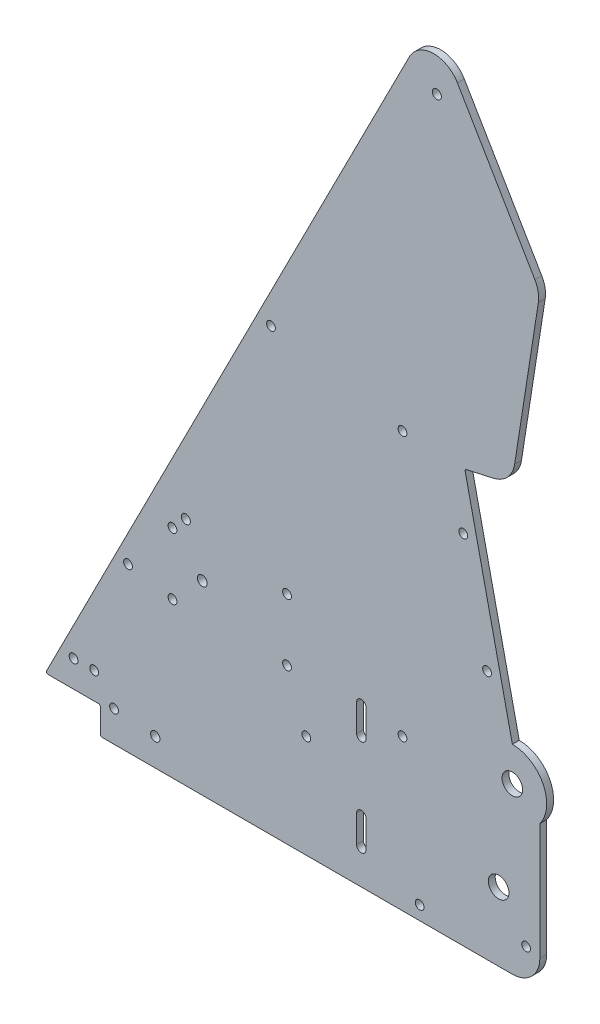
from build123d import *

# Parameters (mm, degrees)
BOSS_EXTRUDE1_DEPTH = 3.175
SKETCH2_R           = 2.0955
SKETCH2_R_2         = 2.286
SKETCH2_R_3         = 2.032
SKETCH2_R_4         = 4.7625
CUT_EXTRUDE1_DEPTH  = 421.976111717
SKETCH7_R           = 2.159
CUT_EXTRUDE2_DEPTH  = 421.976111717
CUT_EXTRUDE3_REACH  = 422.976
SKETCH10_R          = 2.032
FILLET1_R           = 12.7
FILLET2_R           = 0.79375
SKETCH12_R          = 2.032
CUT_EXTRUDE5_DEPTH  = 410.593447353
SKETCH13_R          = 2.032
CUT_EXTRUDE6_DEPTH  = 410.593447353


with BuildPart() as part:
    # Sketch1 → Boss-Extrude1 (new body)
    with BuildSketch(Plane.XY):
        with BuildLine():
            Line((228.6, -12.7), (228.6, 53.975))
            ThreePointArc((228.6, 53.975), (230.099031657, 70.599515829), (215.9, 79.375))
            Line((215.9, 79.375), (193.909735224, 178.566674323))
            Line((193.909735224, 178.566674323), (215.607913982, 183.377044743))
            Line((215.607913982, 183.377044743), (228.6, 266.7))
            Line((228.6, 266.7), (178.754725958, 351.413083686))
            Line((178.754725958, 351.413083686), (0, 0))
            Line((0, 0), (25.4, 0))
            Line((25.4, 0), (25.4, -12.7))
            Line((25.4, -12.7), (228.6, -12.7))
        make_face()
    extrude(amount=BOSS_EXTRUDE1_DEPTH)

    # Sketch2 → Cut-Extrude1 (cut, through all)
    with BuildSketch(Plane.XY.offset(3.175)):
        with Locations((64.943150167, 94.057839899)):
            Circle(SKETCH2_R)
        with Locations((180.975, 322.164313376)):
            Circle(SKETCH2_R)
        with Locations((72.544547852, 73.173171402)):
            Circle(SKETCH2_R_2)
        with Locations((193.207821773, 152.394364194)):
            Circle(SKETCH2_R_3)
        with Locations((215.9, 63.5)):
            Circle(SKETCH2_R_4)
        with Locations((173.0375, -6.35)):
            Circle(SKETCH2_R_3)
        with Locations((204.202954161, 102.798527032)):
            Circle(SKETCH2_R_3)
        with Locations((209.55, 19.05)):
            Circle(SKETCH2_R_4)
        with Locations((165.1, 179.3875)):
            Circle(SKETCH2_R_3)
        with Locations((111.724047852, 87.460671402)):
            Circle(SKETCH2_R_3)
        with Locations((111.724047852, 58.885671402)):
            Circle(SKETCH2_R_3)
        with Locations((58.765047852, 58.885671402)):
            Circle(SKETCH2_R_3)
        with Locations((58.765047852, 87.460671402)):
            Circle(SKETCH2_R_3)
    extrude(amount=-CUT_EXTRUDE1_DEPTH, mode=Mode.SUBTRACT)

    # Sketch7 → Cut-Extrude2 (cut, through all)
    with BuildSketch(Plane.XY.offset(3.175)):
        with Locations((50.8, 0)):
            Circle(SKETCH7_R)
        with BuildLine():
            Line((143.891, 3.175), (143.891, 15.875))
            ThreePointArc((143.891, 15.875), (146.05, 18.034), (148.209, 15.875))
            Line((148.209, 15.875), (148.209, 3.175))
            ThreePointArc((148.209, 3.175), (146.05, 1.016), (143.891, 3.175))
        make_face()
        with BuildLine():
            Line((143.891, 47.625), (143.891, 60.325))
            ThreePointArc((143.891, 60.325), (146.05, 62.484), (148.209, 60.325))
            Line((148.209, 60.325), (148.209, 47.625))
            ThreePointArc((148.209, 47.625), (146.05, 45.466), (143.891, 47.625))
        make_face()
    extrude(amount=-CUT_EXTRUDE2_DEPTH, mode=Mode.SUBTRACT)

    # Sketch10 → Cut-Extrude3 (cut, up to next)
    with BuildSketch(Plane.XY.offset(3.175), mode=Mode.PRIVATE) as cut_extrude3_sk1:
        with Locations((120.65, 34.925)):
            Circle(SKETCH10_R)
    cut_extrude3_tool1 = extrude(cut_extrude3_sk1.sketch, amount=-CUT_EXTRUDE3_REACH, mode=Mode.PRIVATE) & part.part
    # Sketch10 → Cut-Extrude3 (cut, up to next)
    with BuildSketch(Plane.XY.offset(3.175), mode=Mode.PRIVATE) as cut_extrude3_sk2:
        with Locations((165.1, 57.15)):
            Circle(SKETCH10_R)
    cut_extrude3_tool2 = extrude(cut_extrude3_sk2.sketch, amount=-CUT_EXTRUDE3_REACH, mode=Mode.PRIVATE) & part.part
    # Sketch10 → Cut-Extrude3 (cut, up to next)
    with BuildSketch(Plane.XY.offset(3.175), mode=Mode.PRIVATE) as cut_extrude3_sk3:
        with Locations((13.046467246, 12.334704411)):
            Circle(SKETCH10_R)
    cut_extrude3_tool3 = extrude(cut_extrude3_sk3.sketch, amount=-CUT_EXTRUDE3_REACH, mode=Mode.PRIVATE) & part.part
    # Sketch10 → Cut-Extrude3 (cut, up to next)
    with BuildSketch(Plane.XY.offset(3.175), mode=Mode.PRIVATE) as cut_extrude3_sk4:
        with Locations((22.571467246, 12.334704411)):
            Circle(SKETCH10_R)
    cut_extrude3_tool4 = extrude(cut_extrude3_sk4.sketch, amount=-CUT_EXTRUDE3_REACH, mode=Mode.PRIVATE) & part.part
    # Sketch10 → Cut-Extrude3 (cut, up to next)
    with BuildSketch(Plane.XY.offset(3.175), mode=Mode.PRIVATE) as cut_extrude3_sk5:
        with Locations((38.211447917, 62.639810909)):
            Circle(SKETCH10_R)
    cut_extrude3_tool5 = extrude(cut_extrude3_sk5.sketch, amount=-CUT_EXTRUDE3_REACH, mode=Mode.PRIVATE) & part.part
    add(cut_extrude3_tool1.solids().sort_by_distance((120.65, 34.925, 3.175))[0], mode=Mode.SUBTRACT)
    add(cut_extrude3_tool2.solids().sort_by_distance((165.1, 57.15, 3.175))[0], mode=Mode.SUBTRACT)
    add(cut_extrude3_tool3.solids().sort_by_distance((13.046467, 12.334704, 3.175))[0], mode=Mode.SUBTRACT)
    add(cut_extrude3_tool4.solids().sort_by_distance((22.571467, 12.334704, 3.175))[0], mode=Mode.SUBTRACT)
    add(cut_extrude3_tool5.solids().sort_by_distance((38.211448, 62.639811, 3.175))[0], mode=Mode.SUBTRACT)

    # Fillet1
    fillet1_edges = [part.edges().sort_by_distance(p)[0] for p in [
        (228.6, -12.7, 1.5875),
        (178.754725958, 351.413083686, 1.5875),
        (215.607913982, 183.377044743, 1.5875),
        (228.6, 266.7, 1.5875),
    ]]
    fillet(fillet1_edges, radius=FILLET1_R)

    # Fillet2
    fillet2_edges = [part.edges().sort_by_distance(p)[0] for p in [
        (25.4, -12.7, 1.5875),
        (25.4, 0, 1.5875),
        (193.909735224, 178.566674323, 1.5875),
        (0, 0, 1.5875),
    ]]
    fillet(fillet2_edges, radius=FILLET2_R)

    # Sketch12 → Cut-Extrude5 (cut, through all)
    with BuildSketch(Plane.XY.offset(3.175)):
        with Locations((31.75, 1.5875)):
            Circle(SKETCH12_R)
        with Locations((173.0375, -6.35)):
            Circle(SKETCH12_R)
        with Locations((222.25, 1.5875)):
            Circle(SKETCH12_R)
    extrude(amount=-CUT_EXTRUDE5_DEPTH, mode=Mode.SUBTRACT)

    # Sketch13 → Cut-Extrude6 (cut, through all)
    with BuildSketch(Plane.XY.offset(3.175)):
        with Locations((104.321757764, 191.07999269)):
            Circle(SKETCH13_R)
    extrude(amount=-CUT_EXTRUDE6_DEPTH, mode=Mode.SUBTRACT)


solid = part.part
